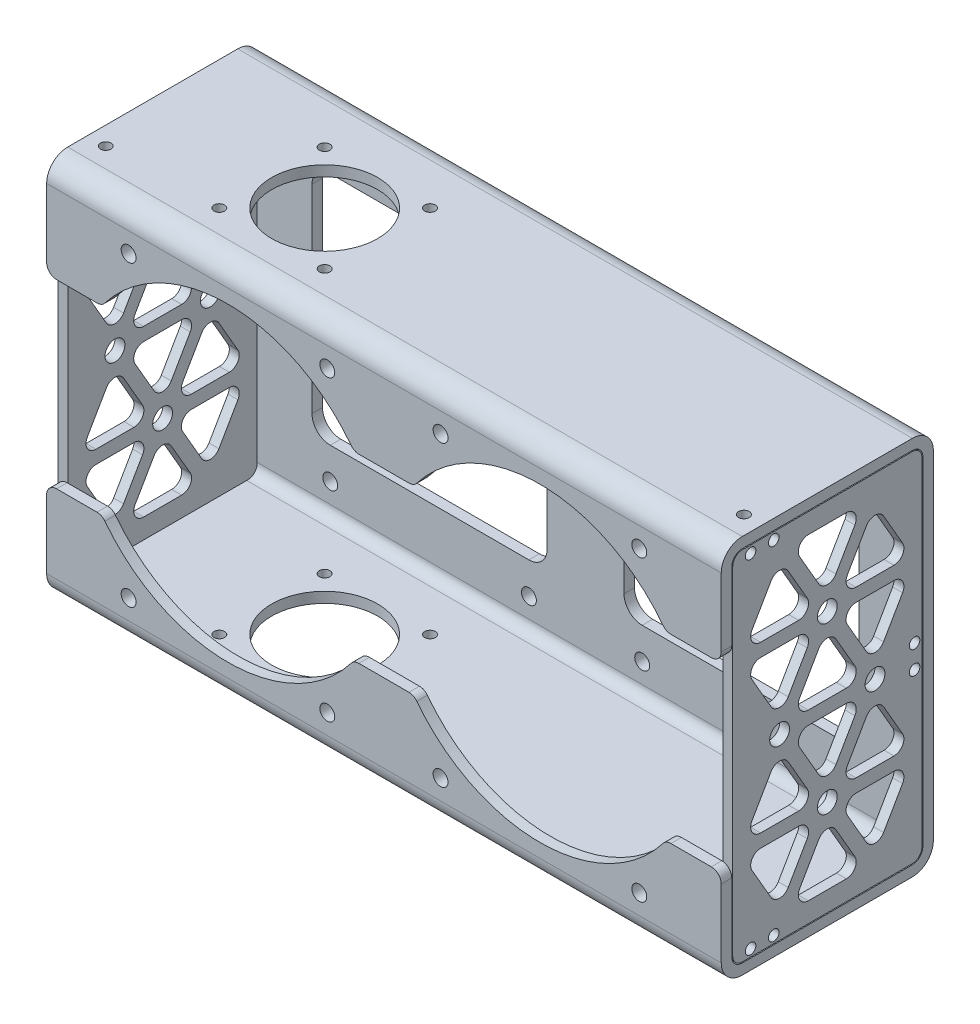
from build123d import *

# Parameters (mm, degrees)
BOSS_EXTRUDE2_DEPTH           = 51
BOSS_EXTRUDE2_DEPTH_BACK      = 51
SKETCH4_R                     = 2.25
SKETCH4_W                     = 71
SKETCH4_H                     = 71
CUT_EXTRUDE1_DEPTH            = 161.039651337
FILLET1_R                     = 5.5
FILLET1_OF_MIRROR6_R          = 5.5
CONVERT_SOLID1_START          = -54.5
CONVERT_SOLID1_OUTLINE_W      = 102
CONVERT_SOLID1_OUTLINE_H      = 2.825
CONVERT_SOLID1_DEPTH          = 203.2
CONVERT_SOLID1_2_DEPTH        = 6
CONVERT_SOLID1_START_2        = 142.7
CONVERT_SOLID1_3_DEPTH        = 6
EDGE_FLANGE11_DEPTH           = 191.2
EDGE_FLANGE11_BEND_DEPTH      = 191.2
CUT_EXTRUDE6_DEPTH            = 188.425913049
CUT_EXTRUDE6_DEPTH_BACK       = 188.425913049
SKETCH65_R                    = 16
SKETCH65_R_2                  = 1.6
EDGE_FLANGE12_STRIP_W         = 19.05
EDGE_FLANGE12_STRIP_H         = 3.175
EDGE_FLANGE12_STRIP_CUT_DEPTH = 191.2
EDGE_FLANGE12_DEPTH           = 191.2
SKETCH71_R                    = 45.85
SKETCH71_R_2                  = 2.25
CUT_EXTRUDE8_DEPTH            = 3.175
MOVE_START                    = 40.1135
MOVE_FACE1_DEPTH              = 3.175
BOSS_EXTRUDE3_DEPTH           = 6.25
SKETCH77_R                    = 1.6
CUT_EXTRUDE9_DEPTH            = 3.175
SKETCH78_R                    = 1.6
CUT_EXTRUDE10_DEPTH           = 192.044032509
SKETCH79_R                    = 1.6
BOSS_EXTRUDE4_DEPTH           = 3
FILLET2_R                     = 3
MOVE_FACE2_BY                 = 0.3
MOVE_FACE2_2_BY               = 0.3
MOVE_FACE2_3_BY               = 0.3
MOVE_FACE2_4_BY               = 0.3
MOVE_FACE2_5_BY               = 0.3
MOVE_FACE2_6_BY               = 0.3
MOVE_FACE2_7_BY               = 0.3
MOVE_FACE2_8_BY               = 0.3
CUT_EXTRUDE11_DEPTH           = 217.001404468
CUT_EXTRUDE11_DEPTH_BACK      = 217.001404468
SKETCH82_R                    = 3
BOSS_EXTRUDE5_DEPTH           = 3


# Read off the part's stored shape, not the designer's step: Convert-Solid1, Move Face1
# Sheet-metal steps are written as plain solids
with BuildPart() as part:
    # Sketch3 → Boss-Extrude2 (new, two sides: drawn at the far end of the back side and taken through both)
    with BuildSketch(Plane(origin=(0, 0, 0), x_dir=(1, 0, 0), z_dir=(0, 1, 0)).offset(-BOSS_EXTRUDE2_DEPTH_BACK)):
        Polygon((-48.5, -30), (-54.5, -30), (-54.5, 23.5865), (148.7, 23.5865), (148.7, -30), (142.7, -30), (142.7, 17.5865), (-48.5, 17.5865), align=None)
    extrude(amount=BOSS_EXTRUDE2_DEPTH + BOSS_EXTRUDE2_DEPTH_BACK)

    # Sketch4 → Cut-Extrude1 (cut, through all)
    with BuildSketch(Plane.XY):
        with Locations((-30, 45)):
            Circle(SKETCH4_R)
        with Locations((30, 45)):
            Circle(SKETCH4_R)
        with Locations((30, -45)):
            Circle(SKETCH4_R)
        with Locations((-30, -45)):
            Circle(SKETCH4_R)
        Rectangle(SKETCH4_W, SKETCH4_H)
    cut_extrude1 = extrude(amount=-CUT_EXTRUDE1_DEPTH, mode=Mode.SUBTRACT)

    # Fillet1
    fillet1_edges = [part.edges().sort_by_distance(p)[0] for p in [
        (-35.5, -35.5, -20.5865),
        (-35.5, 35.5, -20.5865),
        (35.5, 35.5, -20.5865),
        (35.5, -35.5, -20.5865),
    ]]
    fillet(fillet1_edges, radius=FILLET1_R)

    # Mirror6: Cut-Extrude1 across plane
    add(cut_extrude1.mirror(Plane(origin=(47.1, 0, 0), x_dir=(0, 0, 1), z_dir=(1, 0, 0))), mode=Mode.SUBTRACT)

    # Fillet1 of Mirror6
    fillet1_of_mirror6_edges = [part.edges().sort_by_distance(p)[0] for p in [
        (129.7, -35.5, -20.5865),
        (129.7, 35.5, -20.5865),
        (58.7, 35.5, -20.5865),
        (58.7, -35.5, -20.5865),
    ]]
    fillet(fillet1_of_mirror6_edges, radius=FILLET1_OF_MIRROR6_R)

    # Convert-Solid1 outline → Convert-Solid1 (cut)
    with BuildSketch(Plane.YZ.offset(CONVERT_SOLID1_START)):
        with Locations((0, -22.174)):
            Rectangle(CONVERT_SOLID1_OUTLINE_W, CONVERT_SOLID1_OUTLINE_H)
    extrude(amount=CONVERT_SOLID1_DEPTH, mode=Mode.SUBTRACT)

    # Convert-Solid1 2 outline → Convert-Solid1 2 (cut)
    with BuildSketch(Plane.YZ.offset(CONVERT_SOLID1_START)):
        Polygon((-51, 30), (-51, -20.7615), (-35.5, -20.7615), (35.5, -20.7615), (51, -20.7615), (51, 30), align=None)
    extrude(amount=CONVERT_SOLID1_2_DEPTH, mode=Mode.SUBTRACT)

    # Convert-Solid1 3 outline → Convert-Solid1 3 (cut)
    with BuildSketch(Plane.YZ.offset(CONVERT_SOLID1_START_2)):
        Polygon((-51, 30), (-51, -20.7615), (-35.5, -20.7615), (35.5, -20.7615), (51, -20.7615), (51, 30), align=None)
    extrude(amount=CONVERT_SOLID1_3_DEPTH, mode=Mode.SUBTRACT)

    # Edge-Flange11 section (across the edge) → Edge-Flange11 (add)
    with BuildSketch(Plane(origin=(142.7, 54.175, -17.5865), x_dir=(0, -1, 0), z_dir=(-1, 0, 0))):
        with BuildLine():
            Line((-3.175, 3.175), (-3.175, 57.7))
            Line((-3.175, 57.7), (0, 57.7))
            Line((0, 57.7), (0, 3.175))
            ThreePointArc((0, 3.175), (0.92993597, 0.92993597), (3.175, 0))
            Line((3.175, 0), (3.175, -3.175))
            ThreePointArc((3.175, -3.175), (-1.315128061, -1.315128061), (-3.175, 3.175))
        make_face()
    extrude(amount=EDGE_FLANGE11_DEPTH)

    # Edge-Flange11 section 2 (across the edge) → Edge-Flange11 bend (add)
    with BuildSketch(Plane(origin=(-48.5, -54.175, -17.5865), x_dir=(0, 1, 0), z_dir=(1, 0, 0))):
        with BuildLine():
            Line((-3.175, 3.175), (-3.175, 57.7))
            Line((-3.175, 57.7), (0, 57.7))
            Line((0, 57.7), (0, 3.175))
            ThreePointArc((0, 3.175), (0.92993597, 0.92993597), (3.175, 0))
            Line((3.175, 0), (3.175, -3.175))
            ThreePointArc((3.175, -3.175), (-1.315128061, -1.315128061), (-3.175, 3.175))
        make_face()
    extrude(amount=EDGE_FLANGE11_BEND_DEPTH)

    # Sketch65 → Cut-Extrude6 (cut, two sides: drawn at the far end of the back side and taken through both)
    with BuildSketch(Plane.XZ.offset(57.35).offset(-CUT_EXTRUDE6_DEPTH_BACK)):
        with Locations(Location((0, 14.0885, 0), (0, 0, 90))):
            Circle(SKETCH65_R)
        with Locations(Location((-15.909902577, 29.998402577, 0), (0, 0, 90))):
            Circle(SKETCH65_R_2)
        with Locations(Location((15.909902577, 29.998402577, 0), (0, 0, 90))):
            Circle(SKETCH65_R_2)
        with Locations(Location((15.909902577, -1.821402577, 0), (0, 0, 90))):
            Circle(SKETCH65_R_2)
        with Locations(Location((-15.909902577, -1.821402577, 0), (0, 0, 90))):
            Circle(SKETCH65_R_2)
    extrude(amount=CUT_EXTRUDE6_DEPTH + CUT_EXTRUDE6_DEPTH_BACK, mode=Mode.SUBTRACT)

    # Edge-Flange12 strip (across the edge) → Edge-Flange12 strip cut (cut)
    with BuildSketch(Plane(origin=(142.7, 54.175, 40.1135), x_dir=(0, 0, -1), z_dir=(-1, 0, 0))):
        with Locations((-6.35, -1.5875)):
            Rectangle(EDGE_FLANGE12_STRIP_W, EDGE_FLANGE12_STRIP_H)
    edge_flange12_strip_cut = extrude(amount=EDGE_FLANGE12_STRIP_CUT_DEPTH, mode=Mode.SUBTRACT)

    # Edge-Flange12 section (across the edge) → Edge-Flange12 (add)
    with BuildSketch(Plane(origin=(142.7, 54.175, 40.1135), x_dir=(0, 0, -1), z_dir=(-1, 0, 0))):
        with BuildLine():
            Line((-3.175, 3.175), (-3.175, 26.825))
            Line((-3.175, 26.825), (0, 26.825))
            Line((0, 26.825), (0, 3.175))
            ThreePointArc((0, 3.175), (0.92993597, 0.92993597), (3.175, 0))
            Line((3.175, 0), (3.175, -3.175))
            ThreePointArc((3.175, -3.175), (-1.315128061, -1.315128061), (-3.175, 3.175))
        make_face()
    edge_flange12 = extrude(amount=EDGE_FLANGE12_DEPTH)

    # Mirror7: Edge-Flange12 strip cut, Edge-Flange12 across plane
    add(edge_flange12_strip_cut.mirror(Plane.ZX), mode=Mode.SUBTRACT)
    add(edge_flange12.mirror(Plane.ZX))

    # Sketch71 → Cut-Extrude8 (cut)
    with BuildSketch(Plane.XY.offset(43.2885)):
        with Locations((94.2, 0)):
            Circle(SKETCH71_R)
        Circle(SKETCH71_R)
        with Locations(Location((-30, 45, 0), (0, 0, 180))):
            Circle(SKETCH71_R_2)
        with Locations(Location((-30, -45, 0), (0, 0, 180))):
            Circle(SKETCH71_R_2)
        with Locations(Location((30, -45, 0), (0, 0, 180))):
            Circle(SKETCH71_R_2)
        with Locations(Location((30, 45, 0), (0, 0, 180))):
            Circle(SKETCH71_R_2)
        with Locations(Location((64.2, 45, 0), (0, 0, 180))):
            Circle(SKETCH71_R_2)
        with Locations(Location((124.2, 45, 0), (0, 0, 180))):
            Circle(SKETCH71_R_2)
        with Locations(Location((64.2, -45, 0), (0, 0, 180))):
            Circle(SKETCH71_R_2)
        with Locations(Location((124.2, -45, 0), (0, 0, 180))):
            Circle(SKETCH71_R_2)
    extrude(amount=-CUT_EXTRUDE8_DEPTH, mode=Mode.SUBTRACT)

    # Move Face1 outline → Move Face1 (cut)
    with BuildSketch(Plane.XY.offset(MOVE_START)):
        with BuildLine():
            Line((57.400543482, -27.35), (56.161861244, -27.35))
            ThreePointArc((56.161861244, -27.35), (94.2, -46.85), (132.238138756, -27.35))
            Line((132.238138756, -27.35), (130.999456518, -27.35))
            ThreePointArc((130.999456518, -27.35), (94.2, -45.85), (57.400543482, -27.35))
        make_face()
        with BuildLine():
            ThreePointArc((-38.038138756, -27.35), (0, -46.85), (38.038138756, -27.35))
            Line((38.038138756, -27.35), (36.799456518, -27.35))
            ThreePointArc((36.799456518, -27.35), (0, -45.85), (-36.799456518, -27.35))
            Line((-36.799456518, -27.35), (-38.038138756, -27.35))
        make_face()
        with BuildLine():
            Line((130.999456518, 27.35), (132.238138756, 27.35))
            ThreePointArc((132.238138756, 27.35), (94.2, 46.85), (56.161861244, 27.35))
            Line((56.161861244, 27.35), (57.400543482, 27.35))
            ThreePointArc((57.400543482, 27.35), (94.2, 45.85), (130.999456518, 27.35))
        make_face()
        with BuildLine():
            Line((36.799456518, 27.35), (38.038138756, 27.35))
            ThreePointArc((38.038138756, 27.35), (0, 46.85), (-38.038138756, 27.35))
            Line((-38.038138756, 27.35), (-36.799456518, 27.35))
            ThreePointArc((-36.799456518, 27.35), (0, 45.85), (36.799456518, 27.35))
        make_face()
    extrude(amount=MOVE_FACE1_DEPTH, mode=Mode.SUBTRACT)

    # Sketch76 → Boss-Extrude3 (add)
    with BuildSketch(Plane.ZY.offset(48.5)):
        with BuildLine():
            Line((40.1135, 51), (40.1135, 27.35))
            Line((40.1135, 27.35), (43.2885, 27.35))
            Line((43.2885, 27.35), (43.2885, 51))
            ThreePointArc((43.2885, 51), (41.428628061, 55.490128061), (36.9385, 57.35))
            Line((36.9385, 57.35), (-14.4115, 57.35))
            ThreePointArc((-14.4115, 57.35), (-18.901628061, 55.490128061), (-20.7615, 51))
            Line((-20.7615, 51), (-20.7615, -51))
            ThreePointArc((-20.7615, -51), (-18.901628061, -55.490128061), (-14.4115, -57.35))
            Line((-14.4115, -57.35), (36.9385, -57.35))
            ThreePointArc((36.9385, -57.35), (41.428628061, -55.490128061), (43.2885, -51))
            Line((43.2885, -51), (43.2885, -27.35))
            Line((43.2885, -27.35), (40.1135, -27.35))
            Line((40.1135, -27.35), (40.1135, -51))
            ThreePointArc((40.1135, -51), (39.18356403, -53.24506403), (36.9385, -54.175))
            Line((36.9385, -54.175), (-14.4115, -54.175))
            ThreePointArc((-14.4115, -54.175), (-16.65656403, -53.24506403), (-17.5865, -51))
            Line((-17.5865, -51), (-17.5865, 51))
            ThreePointArc((-17.5865, 51), (-16.65656403, 53.24506403), (-14.4115, 54.175))
            Line((-14.4115, 54.175), (36.9385, 54.175))
            ThreePointArc((36.9385, 54.175), (39.18356403, 53.24506403), (40.1135, 51))
        make_face()
    boss_extrude3 = extrude(amount=BOSS_EXTRUDE3_DEPTH)

    # Mirror8: Boss-Extrude3 across plane
    add(boss_extrude3.mirror(Plane(origin=(47.1, 0, 0), x_dir=(0, 0, 1), z_dir=(1, 0, 0))))

    # Sketch77 → Cut-Extrude9 (cut)
    with BuildSketch(Plane.XY.offset(-17.5865)):
        with Locations((-49.25, 0)):
            Circle(SKETCH77_R)
    cut_extrude9 = extrude(amount=-CUT_EXTRUDE9_DEPTH, mode=Mode.SUBTRACT)

    # Sketch78 → Cut-Extrude10 (cut, symmetric)
    with BuildSketch(Plane(origin=(0, -54.175, 0), x_dir=(1, 0, 0), z_dir=(0, 1, 0))):
        with Locations(Location((-49.25, -30.9385, 0), (0, 0, 270))):
            Circle(SKETCH78_R)
    cut_extrude10 = extrude(amount=CUT_EXTRUDE10_DEPTH, both=True, mode=Mode.SUBTRACT)

    # Mirror9: Cut-Extrude9, Cut-Extrude10 across plane
    add(cut_extrude9.mirror(Plane(origin=(47.1, 0, 0), x_dir=(0, 0, 1), z_dir=(1, 0, 0))), mode=Mode.SUBTRACT)
    add(cut_extrude10.mirror(Plane(origin=(47.1, 0, 0), x_dir=(0, 0, 1), z_dir=(1, 0, 0))), mode=Mode.SUBTRACT)

    # Fillet2
    fillet2_edges = [part.edges().sort_by_distance(p)[0] for p in [
        (132.238138756, -27.35, 41.701),
        (56.161861244, -27.35, 41.701),
        (38.038138756, -27.35, 41.701),
        (-38.038138756, -27.35, 41.701),
        (-38.038138756, 27.35, 41.701),
        (38.038138756, 27.35, 41.701),
        (56.161861244, 27.35, 41.701),
        (132.238138756, 27.35, 41.701),
        (-54.75, 27.35, 41.701),
        (-54.75, -27.35, 41.701),
        (148.95, -27.35, 41.701),
        (148.95, 27.35, 41.701),
    ]]
    fillet(fillet2_edges, radius=FILLET2_R)


with BuildPart() as body_2:
    # Sketch79 → Boss-Extrude4 (new body)
    with BuildSketch(Plane(origin=(148.95, 0, 0), x_dir=(0, 0, -1), z_dir=(1, 0, 0))):
        with BuildLine():
            Line((17.5865, -51), (17.5865, 51))
            ThreePointArc((17.5865, 51), (16.65656403, 53.24506403), (14.4115, 54.175))
            Line((14.4115, 54.175), (-36.9385, 54.175))
            ThreePointArc((-36.9385, 54.175), (-39.18356403, 53.24506403), (-40.1135, 51))
            Line((-40.1135, 51), (-40.1135, -51))
            ThreePointArc((-40.1135, -51), (-39.18356403, -53.24506403), (-36.9385, -54.175))
            Line((-36.9385, -54.175), (14.4115, -54.175))
            ThreePointArc((14.4115, -54.175), (16.65656403, -53.24506403), (17.5865, -51))
        make_face()
        with Locations((-34.4385, 51.675)):
            Circle(SKETCH79_R, mode=Mode.SUBTRACT)
        with Locations(Location((-27.4385, 51.675, 0), (0, 0, 180))):
            Circle(SKETCH79_R, mode=Mode.SUBTRACT)
        with Locations((15.0865, 3.5)):
            Circle(SKETCH79_R, mode=Mode.SUBTRACT)
        with Locations(Location((15.0865, -3.5, 0), (0, 0, 180))):
            Circle(SKETCH79_R, mode=Mode.SUBTRACT)
        with Locations(Location((-34.4385, -51.675, 0), (0, 0, 180))):
            Circle(SKETCH79_R, mode=Mode.SUBTRACT)
        with Locations((-27.4385, -51.675)):
            Circle(SKETCH79_R, mode=Mode.SUBTRACT)
    extrude(amount=-BOSS_EXTRUDE4_DEPTH)

    # Move Face2: a curved face moved inward by 0.3
    add(Solid.thicken(body_2.faces().sort_by_distance((147.45, 53.24506403, 39.18356403))[0], -MOVE_FACE2_BY), mode=Mode.SUBTRACT)

    # Move Face2 2: a face moved inward by 0.3
    extrude(body_2.faces().sort_by_distance((147.45, 54.175, 11.2635))[0], amount=MOVE_FACE2_2_BY, dir=(0, -1, 0), mode=Mode.SUBTRACT)

    # Move Face2 3: a curved face moved inward by 0.3
    add(Solid.thicken(body_2.faces().sort_by_distance((147.45, 53.24506403, -16.65656403))[0], -MOVE_FACE2_3_BY), mode=Mode.SUBTRACT)

    # Move Face2 4: a face moved inward by 0.3
    extrude(body_2.faces().sort_by_distance((147.45, 0, -17.5865))[0], amount=MOVE_FACE2_4_BY, dir=(0, 0, 1), mode=Mode.SUBTRACT)

    # Move Face2 5: a curved face moved inward by 0.3
    add(Solid.thicken(body_2.faces().sort_by_distance((147.45, -53.24506403, -16.65656403))[0], -MOVE_FACE2_5_BY), mode=Mode.SUBTRACT)

    # Move Face2 6: a face moved inward by 0.3
    extrude(body_2.faces().sort_by_distance((147.45, -54.175, 11.2635))[0], amount=MOVE_FACE2_6_BY, dir=(0, 1, 0), mode=Mode.SUBTRACT)

    # Move Face2 7: a curved face moved inward by 0.3
    add(Solid.thicken(body_2.faces().sort_by_distance((147.45, -53.24506403, 39.18356403))[0], -MOVE_FACE2_7_BY), mode=Mode.SUBTRACT)

    # Move Face2 8: a face moved inward by 0.3
    extrude(body_2.faces().sort_by_distance((147.45, 0, 40.1135))[0], amount=MOVE_FACE2_8_BY, dir=(0, 0, -1), mode=Mode.SUBTRACT)

    # Sketch81 → Cut-Extrude11 (cut, two sides: drawn at the far end of the back side and taken through both)
    with BuildSketch(Plane(origin=(148.95, 0, 0), x_dir=(0, 0, -1), z_dir=(1, 0, 0)).offset(-CUT_EXTRUDE11_DEPTH_BACK)):
        with BuildLine():
            Line((13.2865, -48.875), (13.2865, 48.875))
            ThreePointArc((13.2865, 48.875), (12.993606781, 49.582106781), (12.2865, 49.875))
            Line((12.2865, 49.875), (-34.8135, 49.875))
            ThreePointArc((-34.8135, 49.875), (-35.520606781, 49.582106781), (-35.8135, 48.875))
            Line((-35.8135, 48.875), (-35.8135, -48.875))
            ThreePointArc((-35.8135, -48.875), (-35.520606781, -49.582106781), (-34.8135, -49.875))
            Line((-34.8135, -49.875), (12.2865, -49.875))
            ThreePointArc((12.2865, -49.875), (12.993606781, -49.582106781), (13.2865, -48.875))
        make_face()
    extrude(amount=CUT_EXTRUDE11_DEPTH + CUT_EXTRUDE11_DEPTH_BACK, mode=Mode.SUBTRACT)

    # Sketch82 → Boss-Extrude5 (add)
    with BuildSketch(Plane(origin=(148.95, 0, 0), x_dir=(0, 0, -1), z_dir=(1, 0, 0))):
        with BuildLine():
            Line((-34.8135, -49.875), (12.2865, -49.875))
            ThreePointArc((12.2865, -49.875), (12.993606781, -49.582106781), (13.2865, -48.875))
            Line((13.2865, -48.875), (13.2865, 48.875))
            ThreePointArc((13.2865, 48.875), (12.993606781, 49.582106781), (12.2865, 49.875))
            Line((12.2865, 49.875), (-34.8135, 49.875))
            ThreePointArc((-34.8135, 49.875), (-35.520606781, 49.582106781), (-35.8135, 48.875))
            Line((-35.8135, 48.875), (-35.8135, -48.875))
            ThreePointArc((-35.8135, -48.875), (-35.520606781, -49.582106781), (-34.8135, -49.875))
        make_face()
        with Locations((-11.2635, 24.9375)):
            Circle(SKETCH82_R, mode=Mode.SUBTRACT)
        with Locations((-11.2635, -24.9375)):
            Circle(SKETCH82_R, mode=Mode.SUBTRACT)
        with Locations((-25.661172338, 0)):
            Circle(SKETCH82_R, mode=Mode.SUBTRACT)
        with Locations((3.134172338, 0)):
            Circle(SKETCH82_R, mode=Mode.SUBTRACT)
        with BuildLine():
            Line((-19.598994511, 43.375), (-13.861576211, 33.4375))
            ThreePointArc((-13.861576211, 33.4375), (-11.2635, 31.9375), (-8.665423789, 33.4375))
            Line((-8.665423789, 33.4375), (-2.928005489, 43.375))
            ThreePointArc((-2.928005489, 43.375), (-2.928005489, 46.375), (-5.5260817, 47.875))
            Line((-5.5260817, 47.875), (-17.0009183, 47.875))
            ThreePointArc((-17.0009183, 47.875), (-19.598994511, 46.375), (-19.598994511, 43.375))
        make_face(mode=Mode.SUBTRACT)
        with BuildLine():
            Line((-2.603245962, 26.9375), (8.871590638, 26.9375))
            ThreePointArc((8.871590638, 26.9375), (11.469666849, 28.4375), (11.469666849, 31.4375))
            Line((11.469666849, 31.4375), (5.732248549, 41.375))
            ThreePointArc((5.732248549, 41.375), (3.134172338, 42.875), (0.536096127, 41.375))
            Line((0.536096127, 41.375), (-5.201322174, 31.4375))
            ThreePointArc((-5.201322174, 31.4375), (-5.201322174, 28.4375), (-2.603245962, 26.9375))
        make_face(mode=Mode.SUBTRACT)
        with BuildLine():
            Line((-5.201322174, 18.4375), (0.536096127, 8.5))
            ThreePointArc((0.536096127, 8.5), (3.134172338, 7), (5.732248549, 8.5))
            Line((5.732248549, 8.5), (11.469666849, 18.4375))
            ThreePointArc((11.469666849, 18.4375), (11.469666849, 21.4375), (8.871590638, 22.9375))
            Line((8.871590638, 22.9375), (-2.603245962, 22.9375))
            ThreePointArc((-2.603245962, 22.9375), (-5.201322174, 21.4375), (-5.201322174, 18.4375))
        make_face(mode=Mode.SUBTRACT)
        with BuildLine():
            Line((-13.861576211, 16.4375), (-19.598994511, 6.5))
            ThreePointArc((-19.598994511, 6.5), (-19.598994511, 3.5), (-17.0009183, 2))
            Line((-17.0009183, 2), (-5.5260817, 2))
            ThreePointArc((-5.5260817, 2), (-2.928005489, 3.5), (-2.928005489, 6.5))
            Line((-2.928005489, 6.5), (-8.665423789, 16.4375))
            ThreePointArc((-8.665423789, 16.4375), (-11.2635, 17.9375), (-13.861576211, 16.4375))
        make_face(mode=Mode.SUBTRACT)
        with BuildLine():
            Line((-19.923754038, 22.9375), (-31.398590638, 22.9375))
            ThreePointArc((-31.398590638, 22.9375), (-33.996666849, 21.4375), (-33.996666849, 18.4375))
            Line((-33.996666849, 18.4375), (-28.259248549, 8.5))
            ThreePointArc((-28.259248549, 8.5), (-25.661172338, 7), (-23.063096127, 8.5))
            Line((-23.063096127, 8.5), (-17.325677826, 18.4375))
            ThreePointArc((-17.325677826, 18.4375), (-17.325677826, 21.4375), (-19.923754038, 22.9375))
        make_face(mode=Mode.SUBTRACT)
        with BuildLine():
            Line((-17.325677826, 31.4375), (-23.063096127, 41.375))
            ThreePointArc((-23.063096127, 41.375), (-25.661172338, 42.875), (-28.259248549, 41.375))
            Line((-28.259248549, 41.375), (-33.996666849, 31.4375))
            ThreePointArc((-33.996666849, 31.4375), (-33.996666849, 28.4375), (-31.398590638, 26.9375))
            Line((-31.398590638, 26.9375), (-19.923754038, 26.9375))
            ThreePointArc((-19.923754038, 26.9375), (-17.325677826, 28.4375), (-17.325677826, 31.4375))
        make_face(mode=Mode.SUBTRACT)
        with BuildLine():
            Line((-19.598994511, -6.5), (-13.861576211, -16.4375))
            ThreePointArc((-13.861576211, -16.4375), (-11.2635, -17.9375), (-8.665423789, -16.4375))
            Line((-8.665423789, -16.4375), (-2.928005489, -6.5))
            ThreePointArc((-2.928005489, -6.5), (-2.928005489, -3.5), (-5.5260817, -2))
            Line((-5.5260817, -2), (-17.0009183, -2))
            ThreePointArc((-17.0009183, -2), (-19.598994511, -3.5), (-19.598994511, -6.5))
        make_face(mode=Mode.SUBTRACT)
        with BuildLine():
            Line((-2.603245962, -22.9375), (8.871590638, -22.9375))
            ThreePointArc((8.871590638, -22.9375), (11.469666849, -21.4375), (11.469666849, -18.4375))
            Line((11.469666849, -18.4375), (5.732248549, -8.5))
            ThreePointArc((5.732248549, -8.5), (3.134172338, -7), (0.536096127, -8.5))
            Line((0.536096127, -8.5), (-5.201322174, -18.4375))
            ThreePointArc((-5.201322174, -18.4375), (-5.201322174, -21.4375), (-2.603245962, -22.9375))
        make_face(mode=Mode.SUBTRACT)
        with BuildLine():
            Line((-5.201322174, -31.4375), (0.536096127, -41.375))
            ThreePointArc((0.536096127, -41.375), (3.134172338, -42.875), (5.732248549, -41.375))
            Line((5.732248549, -41.375), (11.469666849, -31.4375))
            ThreePointArc((11.469666849, -31.4375), (11.469666849, -28.4375), (8.871590638, -26.9375))
            Line((8.871590638, -26.9375), (-2.603245962, -26.9375))
            ThreePointArc((-2.603245962, -26.9375), (-5.201322174, -28.4375), (-5.201322174, -31.4375))
        make_face(mode=Mode.SUBTRACT)
        with BuildLine():
            Line((-13.861576211, -33.4375), (-19.598994511, -43.375))
            ThreePointArc((-19.598994511, -43.375), (-19.598994511, -46.375), (-17.0009183, -47.875))
            Line((-17.0009183, -47.875), (-5.5260817, -47.875))
            ThreePointArc((-5.5260817, -47.875), (-2.928005489, -46.375), (-2.928005489, -43.375))
            Line((-2.928005489, -43.375), (-8.665423789, -33.4375))
            ThreePointArc((-8.665423789, -33.4375), (-11.2635, -31.9375), (-13.861576211, -33.4375))
        make_face(mode=Mode.SUBTRACT)
        with BuildLine():
            Line((-19.923754038, -26.9375), (-31.398590638, -26.9375))
            ThreePointArc((-31.398590638, -26.9375), (-33.996666849, -28.4375), (-33.996666849, -31.4375))
            Line((-33.996666849, -31.4375), (-28.259248549, -41.375))
            ThreePointArc((-28.259248549, -41.375), (-25.661172338, -42.875), (-23.063096127, -41.375))
            Line((-23.063096127, -41.375), (-17.325677826, -31.4375))
            ThreePointArc((-17.325677826, -31.4375), (-17.325677826, -28.4375), (-19.923754038, -26.9375))
        make_face(mode=Mode.SUBTRACT)
        with BuildLine():
            Line((-17.325677826, -18.4375), (-23.063096127, -8.5))
            ThreePointArc((-23.063096127, -8.5), (-25.661172338, -7), (-28.259248549, -8.5))
            Line((-28.259248549, -8.5), (-33.996666849, -18.4375))
            ThreePointArc((-33.996666849, -18.4375), (-33.996666849, -21.4375), (-31.398590638, -22.9375))
            Line((-31.398590638, -22.9375), (-19.923754038, -22.9375))
            ThreePointArc((-19.923754038, -22.9375), (-17.325677826, -21.4375), (-17.325677826, -18.4375))
        make_face(mode=Mode.SUBTRACT)
    extrude(amount=-BOSS_EXTRUDE5_DEPTH)


with BuildPart() as body_3:
    # Mirror10: mirrored copy
    add(body_2.part.mirror(Plane(origin=(47.1, 0, 0), x_dir=(0, 0, 1), z_dir=(1, 0, 0))))


solid = Compound([part.part, body_2.part, body_3.part])
